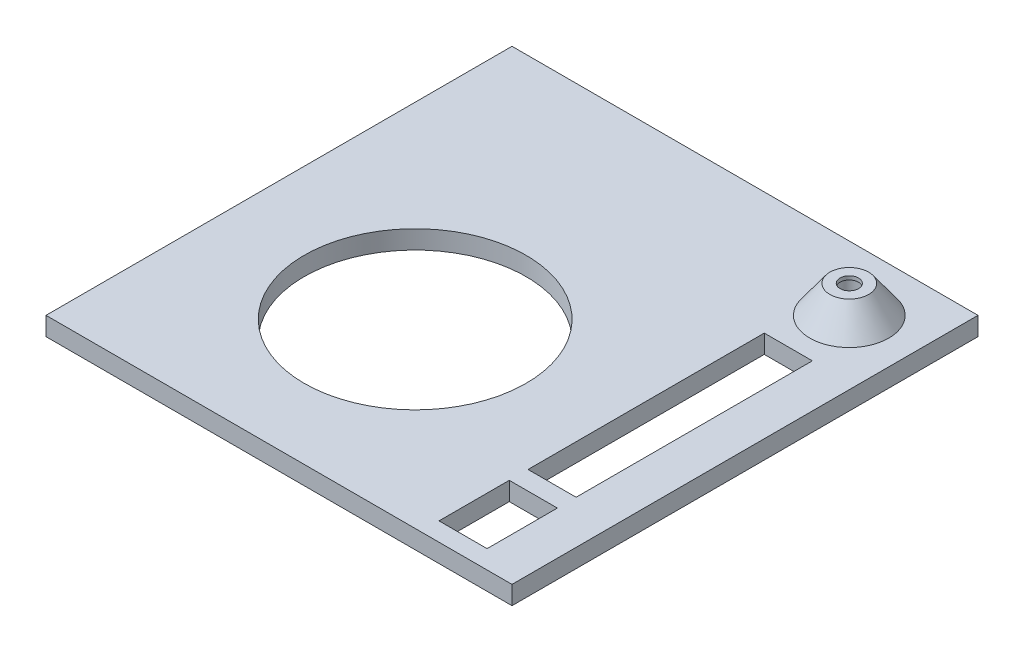
from build123d import *

# Parameters (mm, degrees)
SKETCH1_W           = 126
SKETCH1_H           = 126
BOSS_EXTRUDE1_DEPTH = 5
SKETCH3_R           = 12.5
BOSS_EXTRUDE2_DEPTH = 7.5
SKETCH4_R           = 2.95
CUT_EXTRUDE1_DEPTH  = 11.5
SKETCH6_R           = 2.5
CUT_EXTRUDE2_DEPTH  = 179.628805068
CHAMFER1_SIZE       = 10
CHAMFER1_SIZE_2     = 7.26542528
SKETCH8_W           = 13
SKETCH8_H           = 63.879672954
SKETCH8_H_2         = 19
CUT_EXTRUDE3_DEPTH  = 179.348675353
SKETCH9_R           = 30
CUT_EXTRUDE4_DEPTH  = 179.348675353


with BuildPart() as part:
    # Sketch1 → Boss-Extrude1 (new body)
    with BuildSketch(Plane(origin=(0, 0, 0), x_dir=(1, 0, 0), z_dir=(0, 1, 0))):
        with Locations((63, 63)):
            Rectangle(SKETCH1_W, SKETCH1_H)
    extrude(amount=BOSS_EXTRUDE1_DEPTH)

    # Sketch3 → Boss-Extrude2 (add)
    with BuildSketch(Plane(origin=(0, 5, 0), x_dir=(1, 0, 0), z_dir=(0, 1, 0))):
        with Locations(Location((108.6, 108.6, 0), (0, 0, 90))):
            Circle(SKETCH3_R)
    extrude(amount=BOSS_EXTRUDE2_DEPTH)

    # Sketch4 → Cut-Extrude1 (cut)
    with BuildSketch(Plane.XZ):
        with Locations(Location((108.6, -108.6, 0), (0, 0, 270))):
            Circle(SKETCH4_R)
    extrude(amount=-CUT_EXTRUDE1_DEPTH, mode=Mode.SUBTRACT)

    # Sketch6 → Cut-Extrude2 (cut, through all)
    with BuildSketch(Plane(origin=(0, 12.5, 0), x_dir=(1, 0, 0), z_dir=(0, 1, 0))):
        with Locations(Location((108.6, 108.6, 0), (0, 0, 270))):
            Circle(SKETCH6_R)
    extrude(amount=-CUT_EXTRUDE2_DEPTH, mode=Mode.SUBTRACT)

    # Chamfer1
    # the kernel refuses this chamfer: 10, 7.26542528 mm, written as the material it takes off along each edge
    with BuildSketch(Plane(origin=(108.6, 12.5, -108.6), x_dir=(0, 0, -1), z_dir=(1, 0, 0))) as chamfer1_piece_1_section:
        Polygon((12.5, -CHAMFER1_SIZE), (12.5 - CHAMFER1_SIZE_2, 0), (12.5, 0), align=None)
    chamfer1_piece_1 = revolve(axis=Axis((108.6, 12.5, -108.6), (0, 1, 0)), mode=Mode.PRIVATE)
    chamfer1_piece_1 = split(chamfer1_piece_1, bisect_by=Plane(origin=(108.6, 5, -100.650989912), z_dir=(0, 1, 0)), keep=Keep.TOP, mode=Mode.PRIVATE)
    add(chamfer1_piece_1, mode=Mode.SUBTRACT)

    # Sketch8 → Cut-Extrude3 (cut, through all)
    with BuildSketch(Plane(origin=(0, 5, 0), x_dir=(1, 0, 0), z_dir=(0, 1, 0))):
        with Locations((107.763328316, 61.0093315)):
            Rectangle(SKETCH8_W, SKETCH8_H)
        with Locations((107.763328316, 14.5)):
            Rectangle(SKETCH8_W, SKETCH8_H_2)
    extrude(amount=-CUT_EXTRUDE3_DEPTH, mode=Mode.SUBTRACT)

    # Sketch9 → Cut-Extrude4 (cut, through all)
    with BuildSketch(Plane(origin=(0, 5, 0), x_dir=(1, 0, 0), z_dir=(0, 1, 0))):
        with Locations(Location((50.837155032, 48.974583989, 0), (0, 0, 270))):
            Circle(SKETCH9_R)
    extrude(amount=-CUT_EXTRUDE4_DEPTH, mode=Mode.SUBTRACT)


solid = part.part
